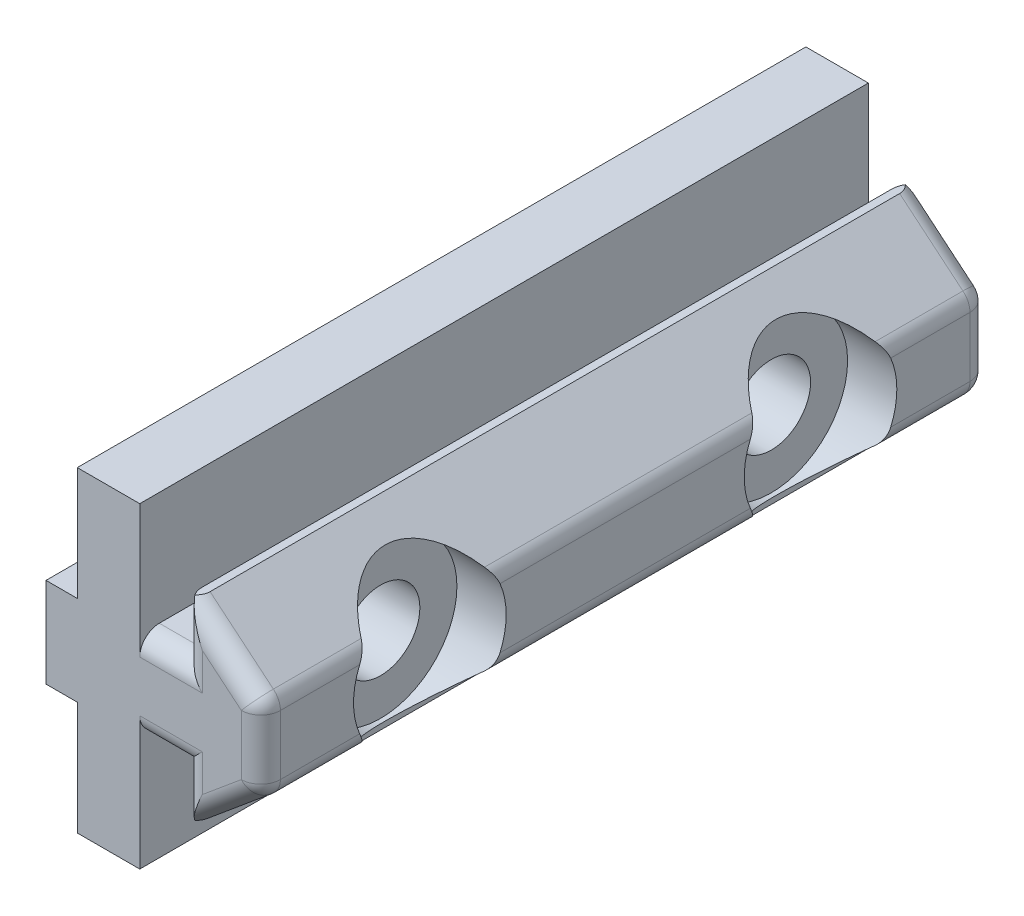
from build123d import *

# Parameters (mm, degrees)
BOSS_EXTRUDE1_DEPTH                             = 47.371
SKETCH2_W                                       = 6.858
SKETCH2_H                                       = 3.429
CUT_EXTRUDE1_DEPTH                              = 49.438972089
SKETCH3_W                                       = 4.064
SKETCH3_H                                       = 47.371
BOSS_EXTRUDE2_DEPTH                             = 7.366
SKETCH4_W                                       = 6.858
SKETCH4_H                                       = 3.429
CUT_EXTRUDE2_DEPTH                              = 50.110425431
SKETCH5_W                                       = 4.064
SKETCH5_H                                       = 47.371
BOSS_EXTRUDE3_DEPTH                             = 7.366
F_3_CLEARANCE_HOLE1_D                           = 2.7686
SKETCH9_W                                       = 2.032
SKETCH9_H                                       = 5.842
BOSS_EXTRUDE4_DEPTH                             = 47.371
SKETCH10_R                                      = 1.3843
CUT_EXTRUDE3_DEPTH                              = 2.54
CBORE_FOR_10_BUTTON_HEAD_CAP_SCREW1_D           = 5.1054
CBORE_FOR_10_BUTTON_HEAD_CAP_SCREW1_CBORE_D     = 9.92124
CBORE_FOR_10_BUTTON_HEAD_CAP_SCREW1_CBORE_DEPTH = 3.2004
FILLET1_R                                       = 1.27
FILLET3_R                                       = 1.27
FILLET5_R                                       = 1.27


with BuildPart() as part:
    # Sketch1 → Boss-Extrude1 (new body)
    with BuildSketch(Plane.XY.offset(23.6855)):
        Polygon((3.302, 6.35), (-4.064, 6.35), (-4.064, -6.35), (3.302, -6.35), (7.874, -2.54), (7.874, 2.54), align=None)
    extrude(amount=-BOSS_EXTRUDE1_DEPTH)

    # Sketch2 → Cut-Extrude1 (cut, through all)
    with BuildSketch(Plane.XY.offset(23.6855)):
        with Locations((-0.635, 4.6355)):
            Rectangle(SKETCH2_W, SKETCH2_H)
    extrude(amount=-CUT_EXTRUDE1_DEPTH, mode=Mode.SUBTRACT)

    # Sketch3 → Boss-Extrude2 (add)
    with BuildSketch(Plane(origin=(0, 2.921, 0), x_dir=(-1, 0, 0), z_dir=(0, 1, 0))):
        with Locations((2.032, 0)):
            Rectangle(SKETCH3_W, SKETCH3_H)
    extrude(amount=BOSS_EXTRUDE2_DEPTH)

    # Sketch4 → Cut-Extrude2 (cut, through all)
    with BuildSketch(Plane.XY.offset(23.6855)):
        with Locations((-0.635, -4.6355)):
            Rectangle(SKETCH4_W, SKETCH4_H)
    extrude(amount=-CUT_EXTRUDE2_DEPTH, mode=Mode.SUBTRACT)

    # Sketch5 → Boss-Extrude3 (add)
    with BuildSketch(Plane.XZ.offset(2.921)):
        with Locations((-2.032, 0)):
            Rectangle(SKETCH5_W, SKETCH5_H)
    extrude(amount=BOSS_EXTRUDE3_DEPTH)

    # #3 Clearance Hole1 (through all)
    with Locations(Plane.ZY.offset(4.064)):
        with Locations((12.7, 0), (-12.7, 0)):
            Hole(F_3_CLEARANCE_HOLE1_D / 2)

    # Sketch9 → Boss-Extrude4 (add, through all)
    with BuildSketch(Plane.XY.offset(23.6855)):
        with Locations((-5.08, 0)):
            Rectangle(SKETCH9_W, SKETCH9_H)
    extrude(amount=-BOSS_EXTRUDE4_DEPTH)

    # Sketch10 → Cut-Extrude3 (cut)
    with BuildSketch(Plane(origin=(-4.064, 0, 0), x_dir=(0, 0, -1), z_dir=(1, 0, 0))):
        with Locations(Location((-12.7, 0, 0), (0, 0, 180))):
            Circle(SKETCH10_R)
    extrude(amount=-CUT_EXTRUDE3_DEPTH, mode=Mode.SUBTRACT)

    # CBORE for #10 Button Head Cap Screw1 (through all)
    with Locations(Plane(origin=(7.874, 0, 0), x_dir=(0, 0, -1), z_dir=(1, 0, 0))):
        with Locations((-12.7, 0), (12.7, 0)):
            CounterBoreHole(CBORE_FOR_10_BUTTON_HEAD_CAP_SCREW1_D / 2, CBORE_FOR_10_BUTTON_HEAD_CAP_SCREW1_CBORE_D / 2, CBORE_FOR_10_BUTTON_HEAD_CAP_SCREW1_CBORE_DEPTH)

    # Fillet1
    fillet1_edges = [part.edges().sort_by_distance(p)[0] for p in [
        (7.874, -2.54, 20.323251747),
        (7.874, -2.54, -20.323251747),
        (7.874, -2.54, 0),
        (7.874, 2.54, 20.323251747),
        (7.874, 2.54, 0),
        (7.874, 2.54, -20.323251747),
    ]]
    fillet(fillet1_edges, radius=FILLET1_R)

    # Fillet3
    # the kernel refuses this fillet: 1.27 mm, written as the material it takes off along each edge
    with BuildSketch(Plane(origin=(0.862897437, -8.382585469, -23.6855), x_dir=(0, 0, 1), z_dir=(0.7682212795973759, 0.6401843996644799, 0)), Plane(origin=(7.417034188, 2.920804844, -23.6855), x_dir=(0, 0, 1), z_dir=(-0.7682212795973759, 0.6401843996644799, 0))) as fillet3_piece_1:
        with BuildLine():
            CenterArc((FILLET3_R, -FILLET3_R), FILLET3_R, 90, 90)
            Line((0, -FILLET3_R), (0, 0))
            Line((0, 0), (FILLET3_R, 0))
        make_face()
    extrude(amount=8.531574072, mode=Mode.SUBTRACT)
    with BuildSketch(Plane(origin=(6.604, -1.945163819, -23.6855), x_dir=(0.6401843996644796, -0.7682212795973762, 0), z_dir=(-0.7682212795973762, -0.6401843996644796, 0))) as fillet3_piece_2:
        with BuildLine():
            CenterArc((1.27 - FILLET3_R, FILLET3_R), FILLET3_R, 270, 90)
            Line((1.27, FILLET3_R), (1.27, 0))
            Line((1.27, 0), (1.27 - FILLET3_R, 0))
        make_face()
    revolve(axis=Axis((6.604, -1.945163819, -23.6855), (0, 0, 1)), revolution_arc=50.194428908, mode=Mode.SUBTRACT)
    with BuildSketch(Plane(origin=(6.604, 1.945163819, -23.6855), x_dir=(0.6401843996644799, 0.7682212795973757, 0), z_dir=(-0.7682212795973757, 0.6401843996644799, 0))) as fillet3_piece_3:
        with BuildLine():
            CenterArc((1.27 - FILLET3_R, -FILLET3_R), FILLET3_R, 0, 90)
            Line((1.27, -FILLET3_R), (1.27, 0))
            Line((1.27, 0), (1.27 - FILLET3_R, 0))
        make_face()
    revolve(axis=Axis((6.604, 1.945163819, -23.6855), (0, 0, -1)), revolution_arc=50.194428908, mode=Mode.SUBTRACT)
    with BuildSketch(Plane(origin=(2.794, -2.921, -23.6855), x_dir=(0, 0, 1), z_dir=(-1, 0, 0)), Plane(origin=(0, 2.921, -23.6855), x_dir=(0, 0, 1), z_dir=(1, 0, 0))) as fillet3_piece_4:
        with BuildLine():
            CenterArc((FILLET3_R, FILLET3_R), FILLET3_R, 180, 90)
            Line((0, FILLET3_R), (0, 0))
            Line((0, 0), (FILLET3_R, 0))
        make_face()
    extrude(amount=2.794, mode=Mode.SUBTRACT)
    with BuildSketch(Plane(origin=(2.794, 2.921, -23.6855), x_dir=(0, 0, 1), z_dir=(0, 1, 0)), Plane(origin=(2.794, -9.525, -23.6855), x_dir=(0, 0, 1), z_dir=(0, 1, 0))) as fillet3_piece_5:
        with BuildLine():
            CenterArc((FILLET3_R, FILLET3_R), FILLET3_R, 180, 90)
            Line((0, FILLET3_R), (0, 0))
            Line((0, 0), (FILLET3_R, 0))
        make_face()
    extrude(amount=6.604, mode=Mode.SUBTRACT)
    with BuildSketch(Plane(origin=(7.874, -1.945163819, -23.6855), x_dir=(-1, 0, 0), z_dir=(0, 1, 0))) as fillet3_piece_6:
        with BuildLine():
            CenterArc((FILLET3_R, FILLET3_R), FILLET3_R, 180, 90)
            Line((0, FILLET3_R), (0, 0))
            Line((0, 0), (FILLET3_R, 0))
        make_face()
    extrude(amount=3.890327637, mode=Mode.SUBTRACT)
    with BuildSketch(Plane(origin=(2.794, -9.525, -23.6855), x_dir=(0, 0, 1), z_dir=(0, 1, 0))) as fillet3_piece_7a_section:
        with BuildLine():
            CenterArc((FILLET3_R, FILLET3_R), FILLET3_R, 180, 90)
            Line((0, FILLET3_R), (0, 0))
            Line((0, 0), (FILLET3_R, 0))
        make_face()
    fillet3_piece_7a = extrude(amount=9.779, mode=Mode.PRIVATE)
    fillet3_piece_7a = split(fillet3_piece_7a, bisect_by=Plane(origin=(3.081521795, -2.921, -23.397978205), z_dir=(0, 1, 0)), keep=Keep.TOP, mode=Mode.PRIVATE)
    with BuildSketch(Plane(origin=(5.969, -2.921, -23.6855), x_dir=(0, 0, 1), z_dir=(-1, 0, 0))) as fillet3_piece_7b_section:
        with BuildLine():
            CenterArc((FILLET3_R, FILLET3_R), FILLET3_R, 180, 90)
            Line((0, FILLET3_R), (0, 0))
            Line((0, 0), (FILLET3_R, 0))
        make_face()
    fillet3_piece_7b = extrude(amount=5.969, mode=Mode.PRIVATE)
    fillet3_piece_7b = split(fillet3_piece_7b, bisect_by=Plane(origin=(2.794, -2.633478205, -23.397978205), z_dir=(1, 0, 0)), keep=Keep.TOP, mode=Mode.PRIVATE)
    fillet3_piece_7 = fillet3_piece_7a & fillet3_piece_7b
    add(fillet3_piece_7, mode=Mode.SUBTRACT)
    with BuildSketch(Plane(origin=(2.794, -0.254, -23.6855), x_dir=(0, 0, 1), z_dir=(0, 1, 0))) as fillet3_piece_8a_section:
        with BuildLine():
            CenterArc((FILLET3_R, FILLET3_R), FILLET3_R, 180, 90)
            Line((0, FILLET3_R), (0, 0))
            Line((0, 0), (FILLET3_R, 0))
        make_face()
    fillet3_piece_8a = extrude(amount=9.779, mode=Mode.PRIVATE)
    fillet3_piece_8a = split(fillet3_piece_8a, bisect_by=Plane(origin=(3.081521795, 2.921, -23.397978205), z_dir=(0, -1, 0)), keep=Keep.TOP, mode=Mode.PRIVATE)
    with BuildSketch(Plane(origin=(0, 2.921, -23.6855), x_dir=(0, 0, 1), z_dir=(1, 0, 0))) as fillet3_piece_8b_section:
        with BuildLine():
            CenterArc((FILLET3_R, FILLET3_R), FILLET3_R, 180, 90)
            Line((0, FILLET3_R), (0, 0))
            Line((0, 0), (FILLET3_R, 0))
        make_face()
    fillet3_piece_8b = extrude(amount=5.969, mode=Mode.PRIVATE)
    fillet3_piece_8b = split(fillet3_piece_8b, bisect_by=Plane(origin=(2.794, 2.633478205, -23.397978205), z_dir=(1, 0, 0)), keep=Keep.TOP, mode=Mode.PRIVATE)
    fillet3_piece_8 = fillet3_piece_8a & fillet3_piece_8b
    add(fillet3_piece_8, mode=Mode.SUBTRACT)

    # Fillet5
    # the kernel refuses this fillet: 1.27 mm, written as the material it takes off along each edge
    with BuildSketch(Plane(origin=(0.862897437, -8.382585469, 23.6855), x_dir=(-0.6401843996644799, 0.7682212795973759, 0), z_dir=(0.7682212795973759, 0.6401843996644799, 0)), Plane(origin=(7.417034188, 2.920804844, 23.6855), x_dir=(-0.6401843996644799, -0.7682212795973759, 0), z_dir=(-0.7682212795973759, 0.6401843996644799, 0))) as fillet5_piece_1:
        with BuildLine():
            CenterArc((FILLET5_R, -FILLET5_R), FILLET5_R, 90, 90)
            Line((0, -FILLET5_R), (0, 0))
            Line((0, 0), (FILLET5_R, 0))
        make_face()
    extrude(amount=8.531574072, mode=Mode.SUBTRACT)
    with BuildSketch(Plane(origin=(6.604, -1.945163819, 23.6855), x_dir=(1, 0, 0), z_dir=(0, 1, 0))) as fillet5_piece_2:
        with BuildLine():
            CenterArc((1.27 - FILLET5_R, FILLET5_R), FILLET5_R, 270, 90)
            Line((1.27, FILLET5_R), (1.27, 0))
            Line((1.27, 0), (1.27 - FILLET5_R, 0))
        make_face()
    revolve(axis=Axis((6.604, -1.945163819, 23.6855), (0, 0, -1)), revolution_arc=50.194428908, mode=Mode.SUBTRACT)
    with BuildSketch(Plane(origin=(6.604, 1.945163819, 23.6855), x_dir=(0.6401843996644799, 0.7682212795973757, 0), z_dir=(-0.7682212795973757, 0.6401843996644799, 0))) as fillet5_piece_3:
        with BuildLine():
            CenterArc((1.27 - FILLET5_R, FILLET5_R), FILLET5_R, 270, 90)
            Line((1.27, FILLET5_R), (1.27, 0))
            Line((1.27, 0), (1.27 - FILLET5_R, 0))
        make_face()
    revolve(axis=Axis((6.604, 1.945163819, 23.6855), (0, 0, -1)), revolution_arc=50.194428908, mode=Mode.SUBTRACT)
    with BuildSketch(Plane(origin=(2.794, 2.921, 23.6855), x_dir=(1, 0, 0), z_dir=(0, 1, 0)), Plane(origin=(2.794, -9.525, 23.6855), x_dir=(1, 0, 0), z_dir=(0, 1, 0))) as fillet5_piece_4:
        with BuildLine():
            CenterArc((FILLET5_R, FILLET5_R), FILLET5_R, 180, 90)
            Line((0, FILLET5_R), (0, 0))
            Line((0, 0), (FILLET5_R, 0))
        make_face()
    extrude(amount=6.604, mode=Mode.SUBTRACT)
    with BuildSketch(Plane(origin=(0, 2.921, 23.6855), x_dir=(0, -1, 0), z_dir=(1, 0, 0)), Plane(origin=(2.794, -2.921, 23.6855), x_dir=(0, 1, 0), z_dir=(-1, 0, 0))) as fillet5_piece_5:
        with BuildLine():
            CenterArc((FILLET5_R, FILLET5_R), FILLET5_R, 180, 90)
            Line((0, FILLET5_R), (0, 0))
            Line((0, 0), (FILLET5_R, 0))
        make_face()
    extrude(amount=2.794, mode=Mode.SUBTRACT)
    with BuildSketch(Plane(origin=(7.874, -1.945163819, 23.6855), x_dir=(-1, 0, 0), z_dir=(0, 1, 0))) as fillet5_piece_6:
        with BuildLine():
            CenterArc((FILLET5_R, -FILLET5_R), FILLET5_R, 90, 90)
            Line((0, -FILLET5_R), (0, 0))
            Line((0, 0), (FILLET5_R, 0))
        make_face()
    extrude(amount=3.890327637, mode=Mode.SUBTRACT)
    with BuildSketch(Plane(origin=(2.794, -0.254, 23.6855), x_dir=(1, 0, 0), z_dir=(0, 1, 0))) as fillet5_piece_7a_section:
        with BuildLine():
            CenterArc((FILLET5_R, FILLET5_R), FILLET5_R, 180, 90)
            Line((0, FILLET5_R), (0, 0))
            Line((0, 0), (FILLET5_R, 0))
        make_face()
    fillet5_piece_7a = extrude(amount=9.779, mode=Mode.PRIVATE)
    fillet5_piece_7a = split(fillet5_piece_7a, bisect_by=Plane(origin=(3.081521795, 2.921, 23.397978205), z_dir=(0, -1, 0)), keep=Keep.TOP, mode=Mode.PRIVATE)
    with BuildSketch(Plane(origin=(0, 2.921, 23.6855), x_dir=(0, -1, 0), z_dir=(1, 0, 0))) as fillet5_piece_7b_section:
        with BuildLine():
            CenterArc((FILLET5_R, FILLET5_R), FILLET5_R, 180, 90)
            Line((0, FILLET5_R), (0, 0))
            Line((0, 0), (FILLET5_R, 0))
        make_face()
    fillet5_piece_7b = extrude(amount=5.969, mode=Mode.PRIVATE)
    fillet5_piece_7b = split(fillet5_piece_7b, bisect_by=Plane(origin=(2.794, 2.633478205, 23.397978205), z_dir=(1, 0, 0)), keep=Keep.TOP, mode=Mode.PRIVATE)
    fillet5_piece_7 = fillet5_piece_7a & fillet5_piece_7b
    add(fillet5_piece_7, mode=Mode.SUBTRACT)
    with BuildSketch(Plane(origin=(2.794, -9.525, 23.6855), x_dir=(1, 0, 0), z_dir=(0, 1, 0))) as fillet5_piece_8a_section:
        with BuildLine():
            CenterArc((FILLET5_R, FILLET5_R), FILLET5_R, 180, 90)
            Line((0, FILLET5_R), (0, 0))
            Line((0, 0), (FILLET5_R, 0))
        make_face()
    fillet5_piece_8a = extrude(amount=9.779, mode=Mode.PRIVATE)
    fillet5_piece_8a = split(fillet5_piece_8a, bisect_by=Plane(origin=(3.081521795, -2.921, 23.397978205), z_dir=(0, 1, 0)), keep=Keep.TOP, mode=Mode.PRIVATE)
    with BuildSketch(Plane(origin=(5.969, -2.921, 23.6855), x_dir=(0, 1, 0), z_dir=(-1, 0, 0))) as fillet5_piece_8b_section:
        with BuildLine():
            CenterArc((FILLET5_R, FILLET5_R), FILLET5_R, 180, 90)
            Line((0, FILLET5_R), (0, 0))
            Line((0, 0), (FILLET5_R, 0))
        make_face()
    fillet5_piece_8b = extrude(amount=5.969, mode=Mode.PRIVATE)
    fillet5_piece_8b = split(fillet5_piece_8b, bisect_by=Plane(origin=(2.794, -2.633478205, 23.397978205), z_dir=(1, 0, 0)), keep=Keep.TOP, mode=Mode.PRIVATE)
    fillet5_piece_8 = fillet5_piece_8a & fillet5_piece_8b
    add(fillet5_piece_8, mode=Mode.SUBTRACT)


solid = part.part
